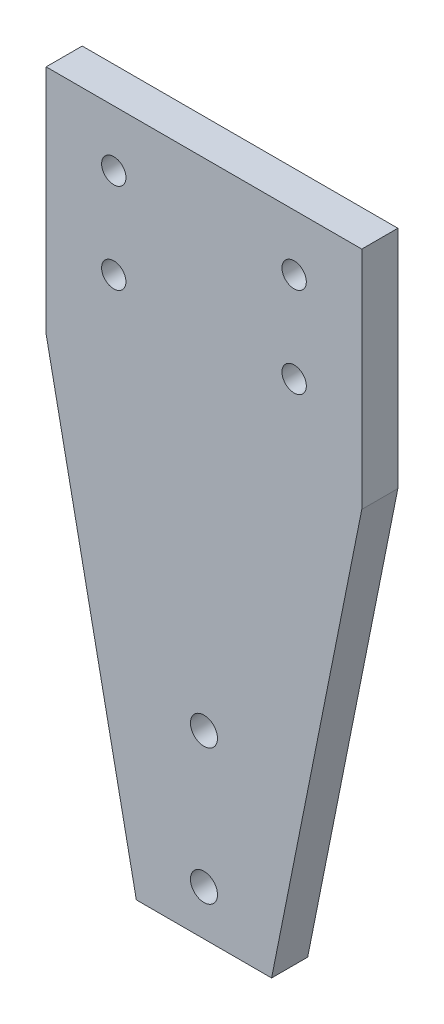
from build123d import *

# Parameters (mm, degrees)
SKETCH1_R           = 3.81
SKETCH1_R_2         = 3.429
BOSS_EXTRUDE1_DEPTH = 10.16


with BuildPart() as part:
    # Sketch1 → Boss-Extrude1 (new body)
    with BuildSketch(Plane.XY):
        Polygon((0, 0), (38.1, 0), (63.5, 127), (63.5, 190.5), (-25.4, 190.5), (-25.4, 125.291623319), align=None)
        with Locations((19.05, 12.7)):
            Circle(SKETCH1_R, mode=Mode.SUBTRACT)
        with Locations((19.05, 50.8)):
            Circle(SKETCH1_R, mode=Mode.SUBTRACT)
        with Locations((-6.35, 174.687730396)):
            Circle(SKETCH1_R_2, mode=Mode.SUBTRACT)
        with Locations((-6.35, 149.287730396)):
            Circle(SKETCH1_R_2, mode=Mode.SUBTRACT)
        with Locations((44.45, 149.287730396)):
            Circle(SKETCH1_R_2, mode=Mode.SUBTRACT)
        with Locations((44.45, 174.687730396)):
            Circle(SKETCH1_R_2, mode=Mode.SUBTRACT)
    extrude(amount=BOSS_EXTRUDE1_DEPTH)


solid = part.part
